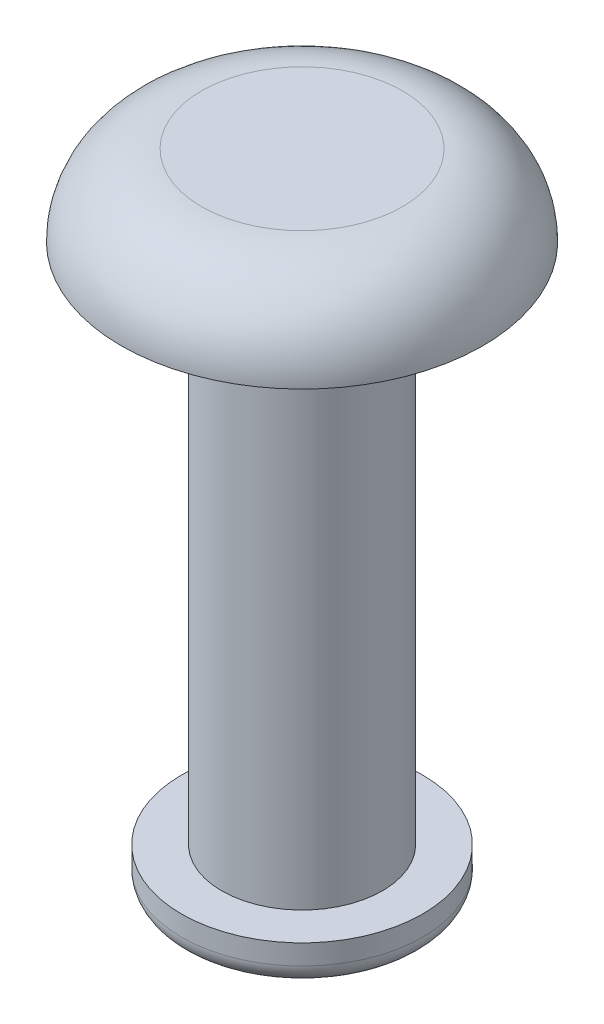
from build123d import *

# Parameters (mm, degrees)
CROQUIS1_R              = 4.5
SALIENTE_EXTRUIR1_DEPTH = 2
CROQUIS2_R              = 2
SALIENTE_EXTRUIR2_DEPTH = 13
REDONDEO1_R             = 2
CROQUIS3_R              = 3
SALIENTE_EXTRUIR3_DEPTH = 1
REDONDEO2_R             = 0.5


with BuildPart() as part:
    # Croquis1 → Saliente-Extruir1 (new body)
    with BuildSketch(Plane(origin=(0, 0, 0), x_dir=(1, 0, 0), z_dir=(0, 1, 0))):
        with Locations(Location((0, 0, 0), (0, 0, 270))):
            Circle(CROQUIS1_R)
    extrude(amount=SALIENTE_EXTRUIR1_DEPTH)

    # Croquis2 → Saliente-Extruir2 (add)
    with BuildSketch(Plane.XZ):
        with Locations(Location((0, 0, 0), (0, 0, 90))):
            Circle(CROQUIS2_R)
    extrude(amount=SALIENTE_EXTRUIR2_DEPTH)

    # Redondeo1
    redondeo1_edges = [part.edges().sort_by_distance(p)[0] for p in [
        (0, 2, -4.5),
    ]]
    fillet(redondeo1_edges, radius=REDONDEO1_R - 0.0001)  # a hair under: the kernel refuses the full size

    # Croquis3 → Saliente-Extruir3 (add)
    with BuildSketch(Plane(origin=(0, -13, 0), x_dir=(-1, 0, 0), z_dir=(0, -1, 0))):
        with Locations(Location((0, 0, 0), (0, 0, 90))):
            Circle(CROQUIS3_R)
    extrude(amount=SALIENTE_EXTRUIR3_DEPTH)

    # Redondeo2
    redondeo2_edges = [part.edges().sort_by_distance(p)[0] for p in [
        (0, -14, 3),
    ]]
    fillet(redondeo2_edges, radius=REDONDEO2_R)


solid = part.part
